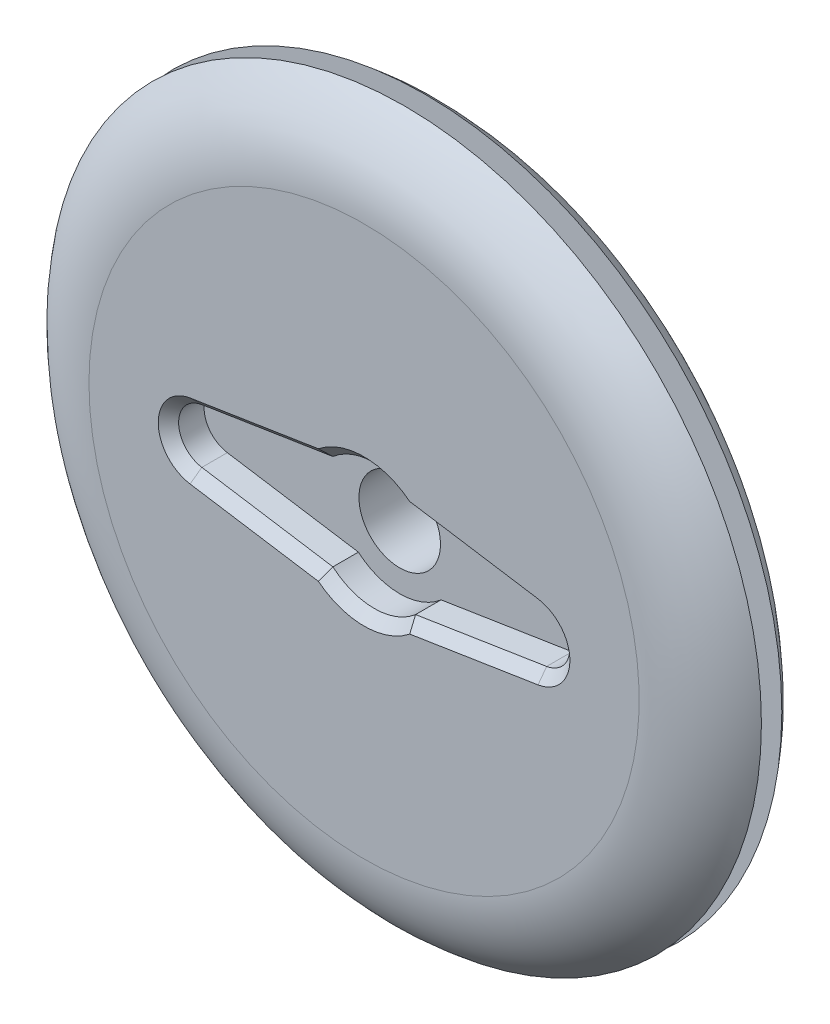
from build123d import *

# Parameters (mm, degrees)
SKETCH_1_R               = 1.5
EXTRUDE_1_DEPTH          = 2.3
SKETCH_2_R               = 4.4
EXTRUDE_2_DEPTH          = 3.2
SKETCH_3_R               = 4.4
SKETCH_3_R_2             = 3.4
SKETCH_3_R_3             = 2.75
SKETCH_3_R_4             = 1.5
CUT_EXTRUDE_1_DEPTH      = 1
BOSS_EXTRUDE1_DEPTH      = 2
BOSS_EXTRUDE1_DEPTH_BACK = 2
SKETCH1_R                = 35
INTERSECT2_OUTLINE_R     = 4.4
INTERSECT2_OUTLINE_R_2   = 3.4
INTERSECT2_OUTLINE_R_3   = 2.75
INTERSECT2_DEPTH         = 5.5
INTERSECT2_START         = 1
INTERSECT2_2_OUTLINE_R   = 4.4
INTERSECT2_2_OUTLINE_R_2 = 3.4
INTERSECT2_2_OUTLINE_R_3 = 2.75
INTERSECT2_2_OUTLINE_R_4 = 1.5
INTERSECT2_2_DEPTH       = 4.5
FILLET1_R                = 10
SKETCH2_R                = 25
BOSS_EXTRUDE2_DEPTH      = 2
SKETCH3_R                = 27
BOSS_EXTRUDE3_DEPTH      = 2
SKETCH4_R                = 6
CUT_EXTRUDE1_DEPTH       = 2
CUT_EXTRUDE3_REACH       = 52.14
SKETCH5_R                = 4
CUT_EXTRUDE4_START       = -2
CUT_EXTRUDE4_DEPTH       = 2
CHAMFER1_SIZE            = 1
CUT_EXTRUDE5_DEPTH       = 1.5


# Read off the part's stored shape, not the designer's step: Intersect2
with BuildPart() as part:
    # Эскиз1 → Бобышка-Вытянуть1 (new body)
    with BuildSketch(Plane.XY):
        with BuildLine():
            Line((-3.968626967, 4.5), (-16.888114198, 2.469689731))
            ThreePointArc((-16.888114198, 2.469689731), (-19, 0), (-16.888114198, -2.469689731))
            Line((-16.888114198, -2.469689731), (-3.968626967, -4.5))
            ThreePointArc((-3.968626967, -4.5), (0, -6), (3.968626967, -4.5))
            Line((3.968626967, -4.5), (16.888114198, -2.469689731))
            ThreePointArc((16.888114198, -2.469689731), (19, 0), (16.888114198, 2.469689731))
            Line((16.888114198, 2.469689731), (3.968626967, 4.5))
            ThreePointArc((3.968626967, 4.5), (0, 6), (-3.968626967, 4.5))
        make_face()
        Circle(SKETCH_1_R, mode=Mode.SUBTRACT)
    extrude(amount=EXTRUDE_1_DEPTH)

    # Эскиз2 → Бобышка-Вытянуть2 (add)
    with BuildSketch(Plane.XY.offset(2.3)):
        with Locations(Location((0, 0, 0), (0, 0, 180))):
            Circle(SKETCH_2_R)
        Polygon((0.333439775, 2.639447604), (0, 3.05), (-0.333439775, 2.639447604), (-0.758504156, 2.954178641), (-0.979368078, 2.473601404), (-1.469348706, 2.672735374), (-1.563759083, 2.15232973), (-2.087868673, 2.223354314), (-2.049893354, 1.695819264), (-2.575200173, 1.634271725), (-2.407225286, 1.132754236), (-2.900722375, 0.942501833), (-2.6133024, 0.498514094), (-3.043981522, 0.191511085), (-2.655176114, -0.167049522), (-2.995976115, -0.571513009), (-2.530215347, -0.822116802), (-2.75972251, -1.298626839), (-2.246271844, -1.42552746), (-2.35006539, -1.944143169), (-1.821186821, -1.939366985), (-1.792745019, -2.467501833), (-1.281669931, -2.33134895), (-1.122779886, -2.835818282), (-0.661621006, -2.576843686), (-0.382266362, -3.025949839), (0, -2.660425857), (0.382266362, -3.025949839), (0.661621006, -2.576843686), (1.122779886, -2.835818282), (1.281669931, -2.33134895), (1.792745019, -2.467501833), (1.821186821, -1.939366985), (2.35006539, -1.944143169), (2.246271844, -1.42552746), (2.75972251, -1.298626839), (2.530215347, -0.822116802), (2.995976115, -0.571513009), (2.655176114, -0.167049522), (3.043981522, 0.191511085), (2.6133024, 0.498514094), (2.900722375, 0.942501833), (2.407225286, 1.132754236), (2.575200173, 1.634271725), (2.049893354, 1.695819264), (2.087868673, 2.223354314), (1.563759083, 2.15232973), (1.469348706, 2.672735374), (0.979368078, 2.473601404), (0.758504156, 2.954178641), align=None, mode=Mode.SUBTRACT)
    extrude(amount=EXTRUDE_2_DEPTH)

    # Эскиз3 → Вырез-Вытянуть1 (cut)
    # profile 1 of 2: a face of its own
    with BuildSketch(Plane(origin=(0, 0, 0), x_dir=(-1, 0, 0), z_dir=(0, 0, -1))):
        Circle(SKETCH_3_R)
        Circle(SKETCH_3_R_2, mode=Mode.SUBTRACT)
    # profile 2 of 2: a face of its own
    with BuildSketch(Plane(origin=(0, 0, 0), x_dir=(-1, 0, 0), z_dir=(0, 0, -1))):
        Circle(SKETCH_3_R_3)
        Circle(SKETCH_3_R_4, mode=Mode.SUBTRACT)
    extrude(amount=-CUT_EXTRUDE_1_DEPTH, mode=Mode.SUBTRACT)


with BuildPart() as body_2:
    # Sketch1 → Boss-Extrude1 (new, two sides: drawn at the far end of the back side and taken through both)
    with BuildSketch(Plane(origin=(0, 0, 0), x_dir=(-1, 0, 0), z_dir=(0, 0, -1)).offset(-BOSS_EXTRUDE1_DEPTH_BACK)):
        Circle(SKETCH1_R)
    extrude(amount=BOSS_EXTRUDE1_DEPTH + BOSS_EXTRUDE1_DEPTH_BACK)


with BuildPart() as intersect2_tool:
    # Intersect2 outline → Intersect2 (new body)
    # profile 1 of 2: a face of its own
    with BuildSketch(Plane.XY):
        with BuildLine():
            ThreePointArc((3.968626967, 4.5), (0, 6), (-3.968626967, 4.5))
            Line((-3.968626967, 4.5), (-16.888114198, 2.469689731))
            ThreePointArc((-16.888114198, 2.469689731), (-19, 0), (-16.888114198, -2.469689731))
            Line((-16.888114198, -2.469689731), (-3.968626967, -4.5))
            ThreePointArc((-3.968626967, -4.5), (0, -6), (3.968626967, -4.5))
            Line((3.968626967, -4.5), (16.888114198, -2.469689731))
            ThreePointArc((16.888114198, -2.469689731), (19, 0), (16.888114198, 2.469689731))
            Line((16.888114198, 2.469689731), (3.968626967, 4.5))
        make_face()
        Circle(INTERSECT2_OUTLINE_R, mode=Mode.SUBTRACT)
    # profile 2 of 2: a face of its own
    with BuildSketch(Plane.XY):
        Circle(INTERSECT2_OUTLINE_R_2)
        Circle(INTERSECT2_OUTLINE_R_3, mode=Mode.SUBTRACT)
    extrude(amount=INTERSECT2_DEPTH)


with BuildPart() as part_1:
    add(part.part)

    # Intersect2: cut by intersect2_tool
    add(intersect2_tool.part, mode=Mode.SUBTRACT)


with BuildPart() as body_2_1:
    add(body_2.part)

    # Intersect2: cut by intersect2_tool
    add(intersect2_tool.part, mode=Mode.SUBTRACT)


with BuildPart() as intersect2_2_tool:
    # Intersect2 2 outline → Intersect2 2 (new body)
    # profile 1 of 2: a face of its own
    with BuildSketch(Plane.XY.offset(INTERSECT2_START)):
        Circle(INTERSECT2_2_OUTLINE_R)
        Circle(INTERSECT2_2_OUTLINE_R_2, mode=Mode.SUBTRACT)
    # profile 2 of 2: a face of its own
    with BuildSketch(Plane.XY.offset(INTERSECT2_START)):
        Circle(INTERSECT2_2_OUTLINE_R_3)
        Circle(INTERSECT2_2_OUTLINE_R_4, mode=Mode.SUBTRACT)
    extrude(amount=INTERSECT2_2_DEPTH)


with BuildPart() as part_2:
    add(part_1.part)

    # Intersect2 2: cut by intersect2_2_tool
    add(intersect2_2_tool.part, mode=Mode.SUBTRACT)


with BuildPart() as body_2_2:
    add(body_2_1.part)

    # Intersect2 2: cut by intersect2_2_tool
    add(intersect2_2_tool.part, mode=Mode.SUBTRACT)

    # Fillet1
    # the kernel refuses this fillet: 10 mm, written as the material it takes off along each edge
    with BuildSketch(Plane(origin=(0, 0, 2), x_dir=(-1, 0, 0), z_dir=(0, -1, 0))) as fillet1_piece_1:
        with BuildLine():
            CenterArc((27, 10), FILLET1_R, 270, 53.130102354)
            Line((27, 0), (27, -0.2))
            Line((27, -0.2), (35, -0.2))
            Line((35, -0.2), (35.2, 0))
            ThreePointArc((35.2, 0), (35.2, 2), (35.16, 3.88))
            Line((35.16, 3.88), (35, 4))
        make_face()
    revolve(axis=Axis((0, 0, 2), (0, 0, -1)), mode=Mode.SUBTRACT)


with BuildPart() as body_2_2_1:
    # Mirror9: mirrored copy
    add(body_2_2.part.mirror(Plane.XY.offset(-3)))


with BuildPart() as body_2_3:
    add(body_2_2.part)

    add(body_2_2_1.part)  # Boss-Extrude2 merges body 2 2
    # Sketch2 → Boss-Extrude2 (add)
    with BuildSketch(Plane(origin=(0, 0, -2), x_dir=(-1, 0, 0), z_dir=(0, 0, -1))):
        Circle(SKETCH2_R)
    extrude(amount=BOSS_EXTRUDE2_DEPTH)

    # Sketch3 → Boss-Extrude3 (add)
    with BuildSketch(Plane(origin=(0, 0, -8), x_dir=(-1, 0, 0), z_dir=(0, 0, -1))):
        Circle(SKETCH3_R)
    extrude(amount=-BOSS_EXTRUDE3_DEPTH)

    # Sketch4 → Cut-Extrude1 (cut)
    with BuildSketch(Plane.XY):
        Circle(SKETCH4_R)
    extrude(amount=CUT_EXTRUDE1_DEPTH, mode=Mode.SUBTRACT)

    # Sketch5 → Cut-Extrude3 (cut, up to next)
    with BuildSketch(Plane.XY, mode=Mode.PRIVATE) as cut_extrude3_sk1:
        Circle(SKETCH5_R)
    cut_extrude3_tool1 = extrude(cut_extrude3_sk1.sketch, amount=-CUT_EXTRUDE3_REACH, mode=Mode.PRIVATE) & body_2_3.part
    add(cut_extrude3_tool1.solids().sort_by_distance((0, 0, 0))[0], mode=Mode.SUBTRACT)

    # Sketch6 → Cut-Extrude4 (cut)
    with BuildSketch(Plane.XY.offset(2).offset(CUT_EXTRUDE4_START)):
        with BuildLine():
            Line((16.919163334, 2.66726491), (4.056712891, 4.68861179))
            ThreePointArc((4.056712891, 4.68861179), (0, 6.2), (-4.056712891, 4.68861179))
            Line((-4.056712891, 4.68861179), (-16.919163334, 2.66726491))
            ThreePointArc((-16.919163334, 2.66726491), (-19.2, 0), (-16.919163334, -2.66726491))
            Line((-16.919163334, -2.66726491), (-4.056712891, -4.68861179))
            ThreePointArc((-4.056712891, -4.68861179), (0, -6.2), (4.056712891, -4.68861179))
            Line((4.056712891, -4.68861179), (16.919163334, -2.66726491))
            ThreePointArc((16.919163334, -2.66726491), (19.2, 0), (16.919163334, 2.66726491))
        make_face()
    extrude(amount=CUT_EXTRUDE4_DEPTH, mode=Mode.SUBTRACT)

    # Chamfer1
    chamfer1_edges = [body_2_3.edges().sort_by_distance(p)[0] for p in [
        (0, 6.2, 2),
        (-10.487938112, 3.67793835, 2),
        (-19.2, 0, 2),
        (-10.487938112, -3.67793835, 2),
        (0, -6.2, 2),
        (10.487938112, -3.67793835, 2),
        (19.2, 0, 2),
        (10.487938112, 3.67793835, 2),
    ]]
    chamfer(chamfer1_edges, length=CHAMFER1_SIZE)

    # Sketch8 → Cut-Extrude5 (cut)
    with BuildSketch(Plane.XY):
        with BuildLine():
            Line((-4.056712891, 4.68861179), (-16.919163334, 2.66726491))
            ThreePointArc((-16.919163334, 2.66726491), (-19.2, 0), (-16.919163334, -2.66726491))
            Line((-16.919163334, -2.66726491), (-4.056712891, -4.68861179))
            ThreePointArc((-4.056712891, -4.68861179), (0, -6.2), (4.056712891, -4.68861179))
            Line((4.056712891, -4.68861179), (16.919163334, -2.66726491))
            ThreePointArc((16.919163334, -2.66726491), (19.2, 0), (16.919163334, 2.66726491))
            Line((16.919163334, 2.66726491), (4.056712891, 4.68861179))
            ThreePointArc((4.056712891, 4.68861179), (0, 6.2), (-4.056712891, 4.68861179))
        make_face()
    extrude(amount=-CUT_EXTRUDE5_DEPTH, mode=Mode.SUBTRACT)


solid = body_2_3.part
